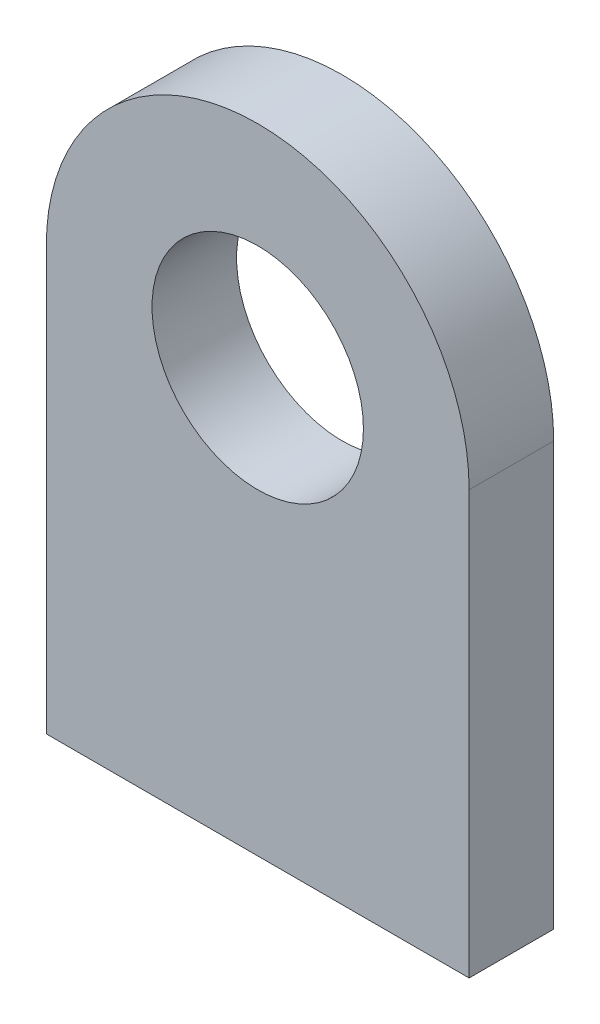
from build123d import *

# Parameters (mm, degrees)
SKETCH1_R           = 3.175
BOSS_EXTRUDE1_DEPTH = 2.54


with BuildPart() as part:
    # Sketch1 → Boss-Extrude1 (new body)
    with BuildSketch(Plane.XY):
        with BuildLine():
            Line((-6.35, 0), (-6.35, -12.7))
            Line((-6.35, -12.7), (6.35, -12.7))
            Line((6.35, -12.7), (6.35, 0))
            ThreePointArc((6.35, 0), (0, 6.35), (-6.35, 0))
        make_face()
        Circle(SKETCH1_R, mode=Mode.SUBTRACT)
    extrude(amount=BOSS_EXTRUDE1_DEPTH)


solid = part.part
